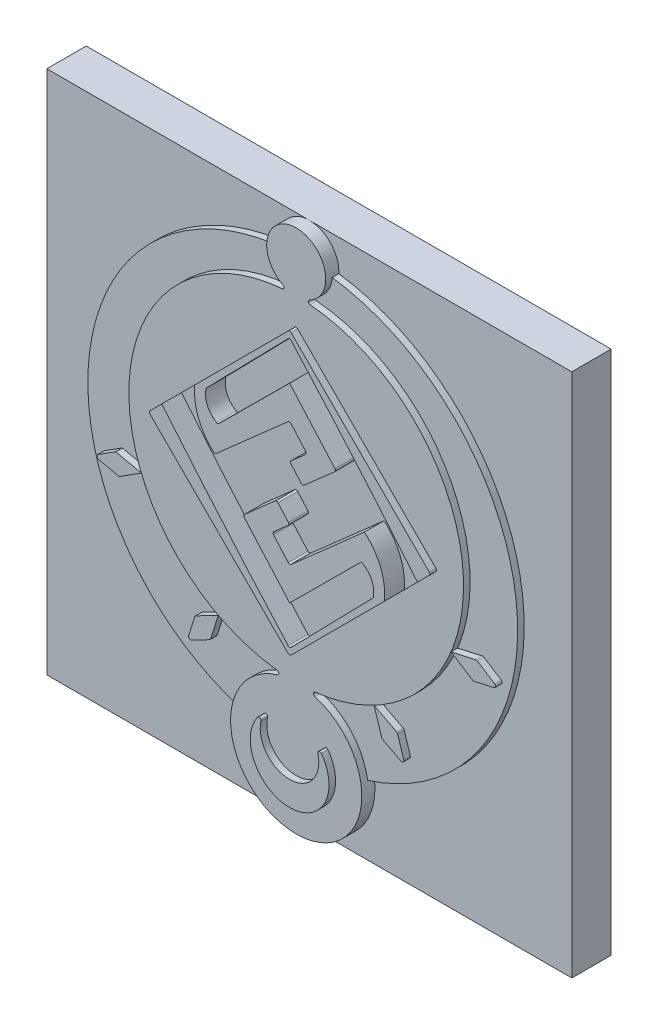
from build123d import *

# Parameters (mm, degrees)
SKETCH_1_W         = 80
SKETCH_1_H         = 80
EXTRUDE_1_DEPTH    = 6
SKETCH_4_R         = 25.5
EXTRUDE_28_DEPTH   = 2
SKETCH_4_14_R      = 4.5
EXTRUDE_36_DEPTH   = 2
SKETCH_4_14_R_2    = 10
EXTRUDE_36_2_DEPTH = 2
EXTRUDE_36_3_DEPTH = 2
EXTRUDE_36_4_DEPTH = 2
EXTRUDE_36_5_DEPTH = 2
EXTRUDE_36_6_DEPTH = 2
EXTRUDE_37_DEPTH   = 3
EXTRUDE_39_DEPTH   = 3
SKETCH_5_R         = 32.75
SKETCH_5_R_2       = 25.5
EXTRUDE_46_DEPTH   = 1
EXTRUDE_49_DEPTH   = 1
EXTRUDE_52_DEPTH   = 2
EXTRUDE_53_DEPTH   = 2
EXTRUDE_54_DEPTH   = 2
EXTRUDE_START      = 1
EXTRUDE_55_DEPTH   = 2


# Read off the part's stored shape, not the designer's step: 凸台-拉伸55
with BuildPart() as part:
    # 草图1 → 凸台-拉伸1 (new body)
    with BuildSketch(Plane.XY):
        Rectangle(SKETCH_1_W, SKETCH_1_H)
    extrude(amount=EXTRUDE_1_DEPTH)

    # 草图4 → 凸台-拉伸28 (add)
    with BuildSketch(Plane.XY.offset(6)):
        with Locations(Location((0, 5.5, 0), (0, 0, 180))):
            Circle(SKETCH_4_R)
        with BuildLine():
            Line((-0.222804873, 26.777187739), (-21.277195127, 5.722099318))
            ThreePointArc((-21.277195127, 5.722099318), (-21.369481763, 5.499289221), (-21.277187739, 5.276482184))
            Line((-21.277187739, 5.276482184), (-0.222812284, -15.777195127))
            ThreePointArc((-0.222812284, -15.777195127), (-2.188e-06, -15.869481763), (0.222804849, -15.777187739))
            Line((0.222804849, -15.777187739), (21.277195104, 5.277900682))
            ThreePointArc((21.277195104, 5.277900682), (21.36948174, 5.500710779), (21.277187716, 5.723517816))
            Line((21.277187716, 5.723517816), (0.222812261, 26.777195127))
            ThreePointArc((0.222812261, 26.777195127), (2.164e-06, 26.869481763), (-0.222804873, 26.777187739))
        make_face(mode=Mode.SUBTRACT)
    extrude(amount=EXTRUDE_28_DEPTH)

    # 草图4<15> → 凸台-拉伸37 (add)
    with BuildSketch(Plane.XY.offset(6)):
        with BuildLine():
            ThreePointArc((0.222812261, 26.777195127), (2.164e-06, 26.869481763), (-0.222804873, 26.777187739))
            Line((-0.222804873, 26.777187739), (-8.153398461, 18.846331171))
            Line((-8.153398461, 18.846331171), (-14.481547304, 12.517972485))
            add(Edge.make_bspline(
                [(-14.481547304, 12.517972485), (-14.671281268, 9.597285815), (-13.708804563, 7.118218354), (-11.618030464, 5.135565229)],
                knots=[0, 0, 0, 0, 0.967858294, 0.967858294, 0.967858294, 0.967858294], degree=3))
            ThreePointArc((-11.618030464, 5.135565229), (-11.406797411, 5.04915788), (-11.19263442, 5.128023881))
            Line((-11.19263442, 5.128023881), (-0.236183394, 14.803864956))
            ThreePointArc((-0.236183394, 14.803864956), (-0.008085477, 14.882175253), (0.208577849, 14.776259411))
            Line((0.208577849, 14.776259411), (2.439198466, 12.250413301))
            ThreePointArc((2.439198466, 12.250413301), (2.517508763, 12.022315384), (2.411592921, 11.805652058))
            Line((2.411592921, 11.805652058), (0.236183394, 9.884508358))
            ThreePointArc((0.236183394, 9.884508358), (0.130267552, 9.667845033), (0.208577849, 9.439747115))
            Line((0.208577849, 9.439747115), (1.77007899, 7.6715793))
            ThreePointArc((1.77007899, 7.6715793), (1.986742316, 7.565663458), (2.214840233, 7.643973755))
            Line((2.214840233, 7.643973755), (6.864887702, 11.750515207))
            ThreePointArc((6.864887702, 11.750515207), (6.970803544, 11.967178533), (6.892493247, 12.19527645))
            Line((6.892493247, 12.19527645), (0, 20))
            Line((0, 20), (-10.766760888, 9.283653907))
            ThreePointArc((-10.766760888, 9.283653907), (-10.956958862, 9.193523834), (-11.161473038, 9.243249591))
            add(Edge.make_bspline(
                [(-12.739199431, 12.964077031), (-13.023767051, 11.375785015), (-12.485025039, 10.108572994), (-11.161473038, 9.243249591)],
                knots=[0, 0, 0, 0, 0.949413484, 0.949413484, 0.949413484, 0.949413484], degree=3))
            Line((-12.739199431, 12.964077031), (-0.234282021, 25.760261044))
            ThreePointArc((-0.234282021, 25.760261044), (-0.002772606, 25.855070903), (0.224859664, 25.75129678))
            add(Edge.make_bspline(
                [(0.224859664, 25.75129678), (6.805789025, 18.468917619), (13.225459434, 11.046572642), (19.483752214, 3.484398322)],
                knots=[0.011258093, 0.011258093, 0.011258093, 0.011258093, 1, 1, 1, 1], degree=3))
            Line((19.483752214, 3.484398322), (21.277195104, 5.277900682))
            ThreePointArc((21.277195104, 5.277900682), (21.36948174, 5.500710779), (21.277187716, 5.723517816))
            Line((21.277187716, 5.723517816), (0.222812261, 26.777195127))
        make_face()
    extrude(amount=EXTRUDE_37_DEPTH)

    # 草图4<17> → 凸台-拉伸39 (add)
    with BuildSketch(Plane.XY.offset(6)):
        with BuildLine():
            add(Edge.make_bspline(
                [(-0.224859664, -14.75129678), (-6.805789024, -7.468917618), (-13.225459435, -0.046572643), (-19.483752214, 7.515601678)],
                knots=[0.011258093, 0.011258093, 0.011258093, 0.011258093, 1, 1, 1, 1], degree=3))
            Line((-19.483752226, 7.51560169), (-21.277195127, 5.722099318))
            ThreePointArc((-21.277195127, 5.722099318), (-21.369481763, 5.499289221), (-21.277187739, 5.276482184))
            Line((-21.277187739, 5.276482184), (-0.222812284, -15.777195127))
            ThreePointArc((-0.222812284, -15.777195127), (-2.188e-06, -15.869481763), (0.222804849, -15.777187739))
            Line((0.222804849, -15.777187739), (14.481547292, -1.517972474))
            add(Edge.make_bspline(
                [(14.481547304, -1.517972485), (14.763245886, 3.03685501), (11.405972883, 6.060379194)],
                knots=[0, 0, 0, 1, 1, 1], degree=2))
            Line((11.405972883, 6.060379194), (0.236183394, -3.803864956))
            ThreePointArc((0.236183394, -3.803864956), (0.008085477, -3.882175253), (-0.208577849, -3.776259411))
            Line((-0.208577849, -3.776259411), (-2.439198466, -1.250413301))
            ThreePointArc((-2.439198466, -1.250413301), (-2.517508763, -1.022315384), (-2.411592921, -0.805652058))
            Line((-2.411592921, -0.805652058), (-0.236183394, 1.115491642))
            ThreePointArc((-0.236183394, 1.115491642), (-0.130267552, 1.332154968), (-0.208577849, 1.560252885))
            Line((-0.208577849, 1.560252885), (-1.77007899, 3.3284207))
            ThreePointArc((-1.77007899, 3.3284207), (-1.986742316, 3.434336542), (-2.214840233, 3.356026245))
            Line((-2.214840233, 3.356026245), (-6.864887702, -0.750515207))
            ThreePointArc((-6.864887702, -0.750515207), (-6.970803544, -0.967178533), (-6.892493247, -1.19527645))
            Line((-6.892493247, -1.19527645), (-1.107936626, -7.745426543))
            Line((-1.107936626, -7.745426543), (0, -9))
            Line((0, -9), (10.943115677, 1.89187511))
            add(Edge.make_bspline(
                [(12.739199431, -1.964077031), (13.168518811, 0.587858851), (10.943115677, 1.89187511)],
                knots=[0, 0, 0, 1, 1, 1], degree=2))
            Line((12.739199431, -1.964077031), (0.234282021, -14.760261044))
            ThreePointArc((0.234282021, -14.760261044), (0.002772606, -14.855070903), (-0.224859664, -14.75129678))
        make_face()
    extrude(amount=EXTRUDE_39_DEPTH)



with BuildPart() as body_2:
    # 草图4<14> → 凸台-拉伸36 (new body)
    with BuildSketch(Plane.XY.offset(6)):
        with Locations((0, 35.5)):
            Circle(SKETCH_4_14_R)
    extrude(amount=EXTRUDE_36_DEPTH)


with BuildPart() as body_3:
    # 草图4<14> → Extrude 36 2 (new body)
    with BuildSketch(Plane.XY.offset(6)):
        with Locations((0, -30)):
            Circle(SKETCH_4_14_R_2)
        with BuildLine():
            ThreePointArc((4.302924706, -26.700427821), (0.019273318, -32.292349048), (-4.357795927, -26.773244316))
            ThreePointArc((-4.357795927, -26.773244316), (-4.524932498, -26.429464628), (-4.894026947, -26.528905038))
            ThreePointArc((-4.894026947, -26.528905038), (0.050444246, -35.999787944), (4.834971562, -26.447106814))
            ThreePointArc((4.834971562, -26.447106814), (4.464257285, -26.353886473), (4.302924706, -26.700427821))
        make_face(mode=Mode.SUBTRACT)
    extrude(amount=EXTRUDE_36_2_DEPTH)


with BuildPart() as body_4:
    # 草图4<14> → Extrude 36 3 (new body)
    with BuildSketch(Plane.XY.offset(6)):
        with BuildLine():
            Line((-23.598991401, -4.161138901), (-27.376750996, -3.323629762))
            ThreePointArc((-27.376750996, -3.323629762), (-27.499667229, -3.320947721), (-27.614253393, -3.365507843))
            Line((-27.614253393, -3.365507843), (-30.23615982, -5.035846454))
            ThreePointArc((-30.23615982, -5.035846454), (-30.377169143, -5.356314517), (-30.13505719, -5.609227963))
            Line((-30.13505719, -5.609227963), (-27.099981617, -6.282088018))
            ThreePointArc((-27.099981617, -6.282088018), (-26.977065384, -6.28477006), (-26.86247922, -6.240209937))
            Line((-26.86247922, -6.240209937), (-23.598991401, -4.161138901))
        make_face()
    extrude(amount=EXTRUDE_36_3_DEPTH)


with BuildPart() as body_5:
    # 草图4<14> → Extrude 36 4 (new body)
    with BuildSketch(Plane.XY.offset(6)):
        with BuildLine():
            Line((-11.867815844, -17.070001043), (-15.300088087, -18.856728881))
            ThreePointArc((-15.300088087, -18.856728881), (-15.395971368, -18.93368335), (-15.455106768, -19.041472951))
            Line((-15.455106768, -19.041472951), (-16.389930653, -22.006355526))
            ThreePointArc((-16.389930653, -22.006355526), (-16.291957161, -22.342487351), (-15.943919015, -22.380603727))
            Line((-15.943919015, -22.380603727), (-13.186410132, -20.945135461))
            ThreePointArc((-13.186410132, -20.945135461), (-13.090526852, -20.868180992), (-13.031391452, -20.760391391))
            Line((-13.031391452, -20.760391391), (-11.867815844, -17.070001043))
        make_face()
    extrude(amount=EXTRUDE_36_4_DEPTH)


with BuildPart() as body_6:
    # 草图4<14> → Extrude 36 5 (new body)
    with BuildSketch(Plane.XY.offset(6)):
        with BuildLine():
            Line((27.614253393, -3.365507843), (30.23615982, -5.035846454))
            ThreePointArc((30.23615982, -5.035846454), (30.377169143, -5.356314517), (30.13505719, -5.609227963))
            Line((30.13505719, -5.609227963), (27.099981617, -6.282088018))
            ThreePointArc((27.099981617, -6.282088018), (26.977065384, -6.28477006), (26.86247922, -6.240209937))
            Line((26.86247922, -6.240209937), (23.598991401, -4.161138901))
            Line((23.598991401, -4.161138901), (27.376750996, -3.323629762))
            ThreePointArc((27.376750996, -3.323629762), (27.499667229, -3.320947721), (27.614253393, -3.365507843))
        make_face()
    extrude(amount=EXTRUDE_36_5_DEPTH)


with BuildPart() as body_7:
    # 草图4<14> → Extrude 36 6 (new body)
    with BuildSketch(Plane.XY.offset(6)):
        with BuildLine():
            Line((13.186410132, -20.945135461), (15.943919015, -22.380603727))
            ThreePointArc((15.943919015, -22.380603727), (16.291957161, -22.342487351), (16.389930653, -22.006355526))
            Line((16.389930653, -22.006355526), (15.455106768, -19.041472951))
            ThreePointArc((15.455106768, -19.041472951), (15.395971368, -18.93368335), (15.300088087, -18.856728881))
            Line((15.300088087, -18.856728881), (11.867815844, -17.070001043))
            Line((11.867815844, -17.070001043), (13.031391452, -20.760391391))
            ThreePointArc((13.031391452, -20.760391391), (13.090526852, -20.868180992), (13.186410132, -20.945135461))
        make_face()
    extrude(amount=EXTRUDE_36_6_DEPTH)


with BuildPart() as body_8:
    # 草图5 → 凸台-拉伸46 (new body)
    with BuildSketch(Plane.XY.offset(6)):
        with Locations((0, 2.75)):
            Circle(SKETCH_5_R)
        with Locations((0, 5.5)):
            Circle(SKETCH_5_R_2, mode=Mode.SUBTRACT)
    extrude(amount=EXTRUDE_46_DEPTH)


with BuildPart() as body_9:
    # 草图4<22> → 凸台-拉伸49 (new body)
    with BuildSketch(Plane.XY.offset(6)):
        with BuildLine():
            ThreePointArc((4.302924706, -26.700427821), (0.019273318, -32.292349048), (-4.357795927, -26.773244316))
            ThreePointArc((-4.357795927, -26.773244316), (-4.524932498, -26.429464628), (-4.894026947, -26.528905038))
            ThreePointArc((-4.894026947, -26.528905038), (0.050444246, -35.999787944), (4.834971562, -26.447106814))
            ThreePointArc((4.834971562, -26.447106814), (4.464257285, -26.353886473), (4.302924706, -26.700427821))
        make_face()
    extrude(amount=EXTRUDE_49_DEPTH)


with BuildPart() as part_1:
    add(part.part)

    add(body_2.part)  # 凸台-拉伸52 merges body 2

    add(body_8.part)  # 凸台-拉伸52 merges body 8
    # 草图4<24> → 凸台-拉伸52 (add)
    with BuildSketch(Plane.XY.offset(6)):
        with BuildLine():
            ThreePointArc((2.018544397, 31.478125), (1.037198751, 31.121162397), (0, 31))
            ThreePointArc((0, 31), (1.064968064, 30.977751922), (2.128077814, 30.911046512))
            ThreePointArc((2.128077814, 30.911046512), (1.858558412, 31.153105437), (2.018544397, 31.478125))
        make_face()
    extrude(amount=EXTRUDE_52_DEPTH)

    # 草图4<25> → 凸台-拉伸53 (add)
    with BuildSketch(Plane.XY.offset(6)):
        with BuildLine():
            ThreePointArc((-2.018544397, 31.478125), (-1.858558412, 31.153105437), (-2.128077814, 30.911046512))
            ThreePointArc((-2.128077814, 30.911046512), (-1.064968064, 30.977751922), (0, 31))
            ThreePointArc((0, 31), (-1.037198751, 31.121162397), (-2.018544397, 31.478125))
        make_face()
    extrude(amount=EXTRUDE_53_DEPTH)


    add(body_3.part)  # 凸台-拉伸54 merges body 3
    # 草图4<26> → 凸台-拉伸54 (add)
    with BuildSketch(Plane.XY.offset(6)):
        with BuildLine():
            ThreePointArc((2.6e-08, -20), (-1.459408174, -19.958203546), (-2.914032211, -19.832951196))
            ThreePointArc((-2.914032211, -19.832951196), (-2.649472878, -20.104653041), (-2.862441692, -20.418432928))
            ThreePointArc((-2.862441692, -20.418432928), (-1.446431678, -20.105161174), (2.6e-08, -20))
        make_face()
        with BuildLine():
            ThreePointArc((2.914032211, -19.832951196), (1.4594082, -19.958203544), (2.6e-08, -20))
            ThreePointArc((2.6e-08, -20), (1.446431705, -20.105161177), (2.862441692, -20.418432928))
            ThreePointArc((2.862441692, -20.418432928), (2.649472878, -20.104653041), (2.914032211, -19.832951196))
        make_face()
    extrude(amount=EXTRUDE_54_DEPTH)


    add(body_9.part)  # 凸台-拉伸55 merges body 9
    # 凸台-拉伸55 outline → 凸台-拉伸55 (add)
    with BuildSketch(Plane.XY.offset(6).offset(EXTRUDE_START)):
        with BuildLine():
            ThreePointArc((4.834971562, -26.447106814), (4.464257285, -26.353886473), (4.302924706, -26.700427821))
            ThreePointArc((4.302924706, -26.700427821), (0.019273318, -32.292349048), (-4.357795927, -26.773244316))
            ThreePointArc((-4.357795927, -26.773244316), (-4.524932498, -26.429464628), (-4.894026947, -26.528905038))
            ThreePointArc((-4.894026947, -26.528905038), (0.050444247, -35.999787944), (4.834971562, -26.447106814))
        make_face()
    extrude(amount=EXTRUDE_55_DEPTH)


solid = Compound([body_4.part, body_5.part, body_6.part, body_7.part, part_1.part])
